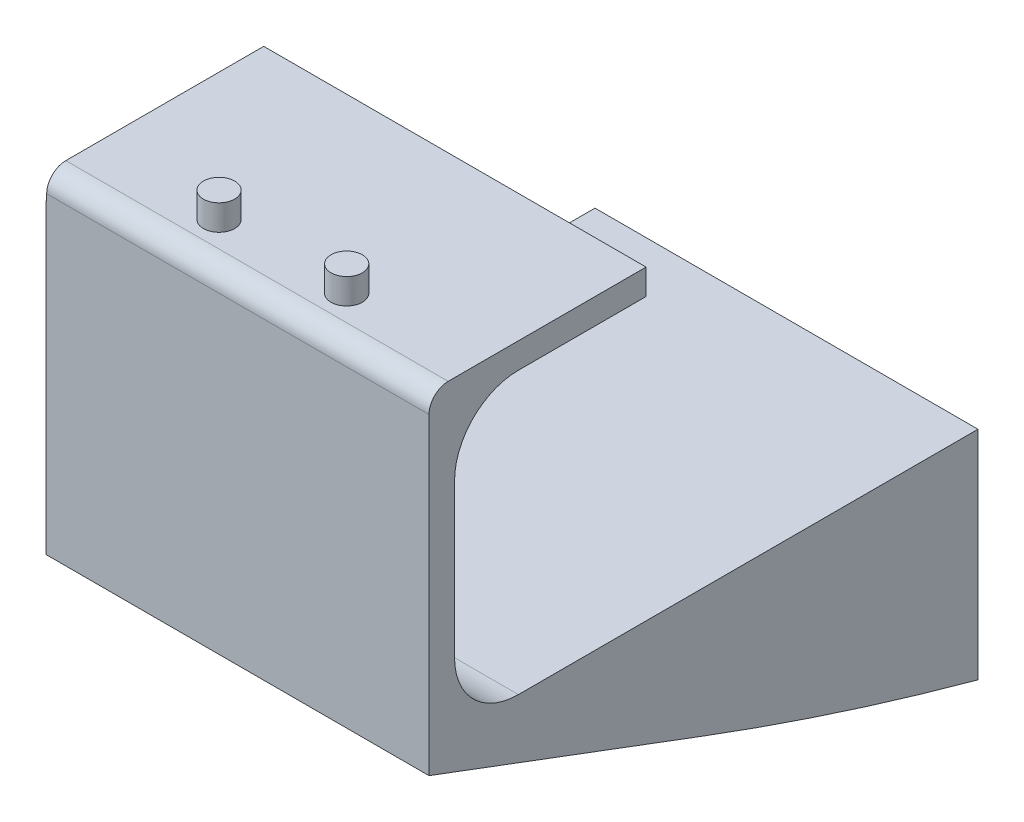
from build123d import *

# Parameters (mm, degrees)
BOSS_EXTRUDE1_DEPTH      = 24.000000335
SKETCH2_W                = 24.000000671
SKETCH2_H                = 21.641136132
BOSS_EXTRUDE2_DEPTH      = 14.161821686
BOSS_EXTRUDE3_DEPTH      = 2.999999665
BOSS_EXTRUDE4_DEPTH      = 21.358863868
SKETCH5_W                = 27.000000671
SKETCH5_H                = 43
BOSS_EXTRUDE5_DEPTH      = 24.000001
CUT_EXTRUDE1_DEPTH       = 6.152247735
SKETCH7_W                = 24.000000671
SKETCH7_H                = 40
CUT_EXTRUDE2_DEPTH       = 8.00957395
BOSS_EXTRUDE6_START      = 3
BOSS_EXTRUDE6_DEPTH      = 3
SKETCH9_W                = 41
SKETCH9_H                = 22.000001
CUT_EXTRUDE3_DEPTH       = 66.345237915
SKETCH10_W               = 29.947000182
SKETCH10_H               = 17
BOSS_EXTRUDE7_DEPTH      = 2
F_5_0_5_DIAMETER_HOLE1_D = 5
FILLET1_R                = 1.5
FILLET2_R                = 5
SKETCH15_R               = 1.225
BOSS_EXTRUDE8_DEPTH      = 2


with BuildPart() as part:
    # Sketch1 → Boss-Extrude1 (new body)
    with BuildSketch(Plane(origin=(18, 0, 0), x_dir=(0, -1, 0), z_dir=(-1, 0, 0))):
        with BuildLine():
            Line((-0.838178314, 3), (-0.838178314, 0))
            Line((-0.838178314, 0), (0, 0))
            ThreePointArc((0, 0), (-0.41433113, 1.501329358), (-0.838178314, 3))
        make_face()
    extrude(amount=-BOSS_EXTRUDE1_DEPTH)

    # Sketch2 → Boss-Extrude2 (add)
    with BuildSketch(Plane(origin=(0, 0.838178314, 0), x_dir=(-1, 0, 0), z_dir=(0, 1, 0))):
        with Locations((-30.000000336, 10.820568066)):
            Rectangle(SKETCH2_W, SKETCH2_H)
    extrude(amount=BOSS_EXTRUDE2_DEPTH)


with BuildPart() as boss_extrude3_tool:
    # Sketch3 → Boss-Extrude3 (new body)
    with BuildSketch(Plane(origin=(42.000000335, 0, 0), x_dir=(0, 0, -1), z_dir=(1, 0, 0))):
        with BuildLine():
            Line((0, 15), (0, 0))
            ThreePointArc((0, 0), (-10.901557165, 3.244484944), (-21.641136132, 6.99042605))
            Line((-21.641136132, 6.99042605), (-43, 15))
            Line((-43, 15), (0, 15))
        make_face()
    extrude(amount=BOSS_EXTRUDE3_DEPTH)


with BuildPart() as part_1:
    add(part.part)


with BuildPart() as part_2:
    # Boss-Extrude3: joined with boss_extrude3_tool
    add(part_1.part.fuse(boss_extrude3_tool.part, tol=0.00001))

    # Sketch4 → Boss-Extrude4 (add)
    with BuildSketch(Plane.XY.offset(21.641136132)):
        Polygon((42.000000671, 15), (42.000000671, 6.99042605), (42.000000671, 0.838178314), (18, 0.838178314), (18, 6.99042605), (18, 15), align=None)
    extrude(amount=BOSS_EXTRUDE4_DEPTH)

    # Sketch5 → Boss-Extrude5 (add)
    with BuildSketch(Plane(origin=(0, 15, 0), x_dir=(-1, 0, 0), z_dir=(0, 1, 0))):
        with Locations((-31.500000336, 21.5)):
            Rectangle(SKETCH5_W, SKETCH5_H)
    extrude(amount=BOSS_EXTRUDE5_DEPTH)

    # Sketch6 → Cut-Extrude1 (cut)
    with BuildSketch(Plane.XZ.offset(-0.838178314)):
        Polygon((18, 3), (42.000000671, 3), (42.000000671, 21.641136132), (42.000000671, 43), (18, 43), align=None)
    extrude(amount=-CUT_EXTRUDE1_DEPTH, mode=Mode.SUBTRACT)

    # Sketch7 → Cut-Extrude2 (cut)
    with BuildSketch(Plane.XZ.offset(-6.99042605)):
        with Locations((30.000000336, 23)):
            Rectangle(SKETCH7_W, SKETCH7_H)
    extrude(amount=-CUT_EXTRUDE2_DEPTH, mode=Mode.SUBTRACT)

    # Sketch8 → Boss-Extrude6 (add)
    with BuildSketch(Plane.ZY.offset(-18).offset(BOSS_EXTRUDE6_START)):
        with BuildLine():
            Line((0, 39.000001), (43, 39.000001))
            Line((43, 39.000001), (43, 15))
            Line((43, 15), (21.641136132, 6.99042605))
            ThreePointArc((21.641136132, 6.99042605), (10.901557165, 3.244484944), (0, 0))
            Line((0, 0), (0, 39.000001))
        make_face()
    extrude(amount=-BOSS_EXTRUDE6_DEPTH)

    # Sketch9 → Cut-Extrude3 (cut, through all)
    with BuildSketch(Plane.ZY.offset(-15)):
        with Locations((20.5, 28.0000005)):
            Rectangle(SKETCH9_W, SKETCH9_H)
    extrude(amount=-CUT_EXTRUDE3_DEPTH, mode=Mode.SUBTRACT)

    # Sketch10 → Boss-Extrude7 (add)
    with BuildSketch(Plane(origin=(0, 39.000001, 0), x_dir=(-1, 0, 0), z_dir=(0, 1, 0))):
        with Locations((-30.02650058, 34.5)):
            Rectangle(SKETCH10_W, SKETCH10_H)
    extrude(amount=BOSS_EXTRUDE7_DEPTH)

    # Ø5.0 (5) Diameter Hole1 (through all)
    with Locations(Plane.XY.offset(3)):
        with Locations((36.000000045, 10), (23.999999955, 10)):
            Hole(F_5_0_5_DIAMETER_HOLE1_D / 2)

    # Fillet1
    fillet1_edges = [part_2.edges().sort_by_distance(p)[0] for p in [
        (30.02650058, 41.000001, 43),
    ]]
    fillet(fillet1_edges, radius=FILLET1_R)

    # Fillet2
    fillet2_edges = [part_2.edges().sort_by_distance(p)[0] for p in [
        (30.000000335, 17, 41),
        (30.02650058, 39.000001, 41),
    ]]
    fillet(fillet2_edges, radius=FILLET2_R)

    # Sketch15 → Boss-Extrude8 (add)
    with BuildSketch(Plane(origin=(0, 41.000001, 0), x_dir=(1, 0, 0), z_dir=(0, 1, 0))):
        with Locations((25.053000489, -39.5)):
            Circle(SKETCH15_R)
        with Locations((35.053000489, -39.5)):
            Circle(SKETCH15_R)
    extrude(amount=BOSS_EXTRUDE8_DEPTH)


solid = part_2.part
